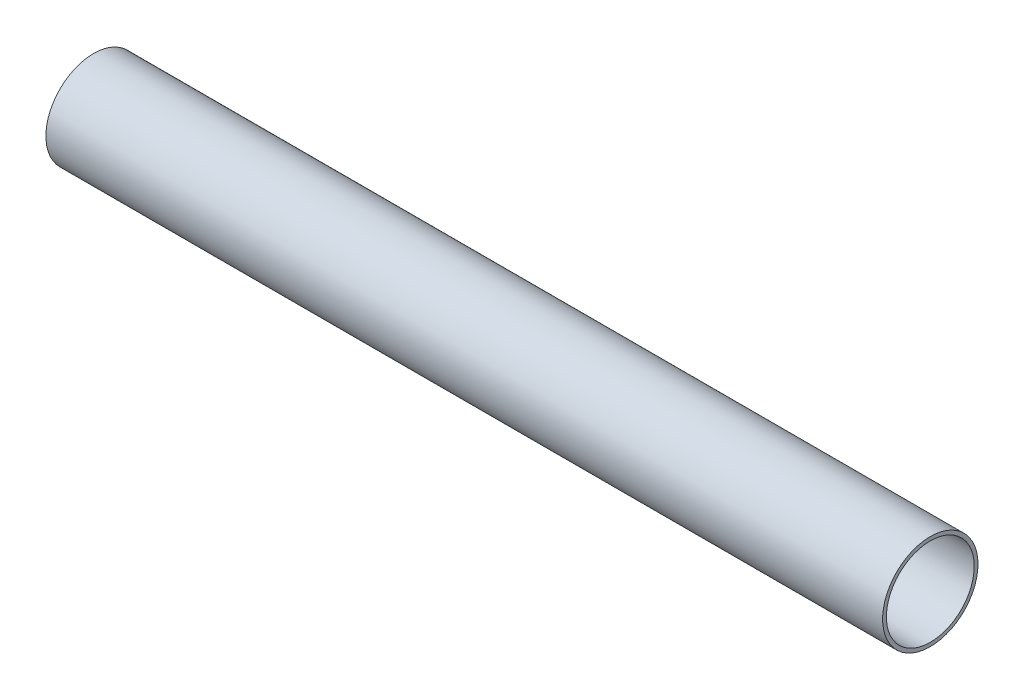
from build123d import *

# Parameters (mm, degrees)
CROQUIS1_R              = 57
CROQUIS1_R_2            = 52.5
SALIENTE_EXTRUIR1_DEPTH = 1000


with BuildPart() as part:
    # Croquis1 → Saliente-Extruir1 (new body)
    with BuildSketch(Plane(origin=(0, 0, 0), x_dir=(0, 0, -1), z_dir=(1, 0, 0))):
        Circle(CROQUIS1_R)
        Circle(CROQUIS1_R_2, mode=Mode.SUBTRACT)
    extrude(amount=SALIENTE_EXTRUIR1_DEPTH)


solid = part.part
